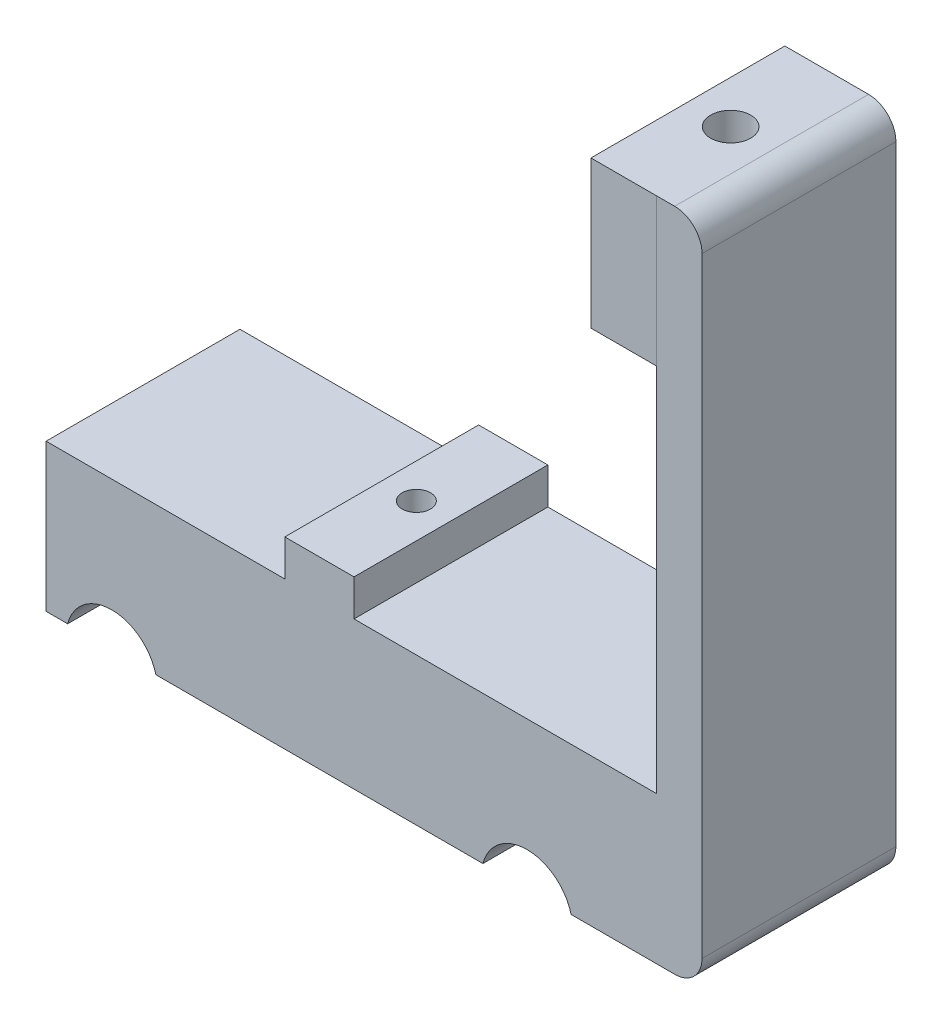
from build123d import *

# Parameters (mm, degrees)
BOSS_EXTRUDE1_DEPTH     = 10.8
BOSS_EXTRUDE2_DEPTH     = 10.64
CUT_EXTRUDE1_DEPTH      = 39.168054705
CUT_EXTRUDE1_DEPTH_BACK = 39.168054705
SKETCH5_R               = 5
FILLET1_R               = 1
SKETCH6_W               = 21.28
SKETCH6_H               = 16.18
BOSS_EXTRUDE3_DEPTH     = 12
SKETCH7_W               = 5
SKETCH7_H               = 21.281328743
BOSS_EXTRUDE4_DEPTH     = 56.83
SKETCH8_W               = 21.284331222
SKETCH8_H               = 16.18
BOSS_EXTRUDE5_DEPTH     = 7.19
FILLET3_R               = 3
SKETCH9_R               = 2.2
CUT_EXTRUDE2_DEPTH      = 85.918196519
SKETCH10_R              = 1.555
CUT_EXTRUDE3_DEPTH      = 85.918196519
SKETCH11_W              = 24.977296572
SKETCH11_H              = 9.721484234
CUT_EXTRUDE4_DEPTH      = 71.220021919


with BuildPart() as part:
    # Sketch2 → Boss-Extrude1 (new body)
    with BuildSketch(Plane.XY):
        Polygon((10.1, 0), (10.1, 1.709943763), (6.25480432, 7), (-6.25480432, 7), (-10.1, 1.709943763), (-10.1, 0), align=None)
    extrude(amount=BOSS_EXTRUDE1_DEPTH)

    # Sketch4 → Boss-Extrude2 (add, symmetric)
    with BuildSketch(Plane.XY):
        Polygon((-3.8, 0), (-3.8, -4.8), (-30, -4.8), (-30, -20.98), (30, -20.98), (30, -4.8), (3.8, -4.8), (3.8, 0), align=None)
    extrude(amount=BOSS_EXTRUDE2_DEPTH, both=True)

    # Sketch5 → Cut-Extrude1 (cut, two sides: drawn at the far end of the back side and taken through both)
    with BuildSketch(Plane.XY.offset(-CUT_EXTRUDE1_DEPTH_BACK)):
        with Locations((-22.790976064, -22.227391232)):
            Circle(SKETCH5_R)
        with Locations((22.790976064, -22.227391232)):
            Circle(SKETCH5_R)
    extrude(amount=CUT_EXTRUDE1_DEPTH + CUT_EXTRUDE1_DEPTH_BACK, mode=Mode.SUBTRACT)

    # Fillet1
    fillet1_edges = [part.edges().sort_by_distance(p)[0] for p in [
        (-10.1, 0, 5.4),
        (-10.1, 1.709943763, 5.4),
        (-6.25480432, 7, 5.4),
        (6.25480432, 7, 5.4),
        (10.1, 0, 5.4),
        (10.1, 1.709943763, 5.4),
    ]]
    fillet(fillet1_edges, radius=FILLET1_R)

    # Sketch6 → Boss-Extrude3 (add)
    with BuildSketch(Plane(origin=(30, 0, 0), x_dir=(0, 0, -1), z_dir=(1, 0, 0))):
        with Locations((0, -12.89)):
            Rectangle(SKETCH6_W, SKETCH6_H)
    extrude(amount=BOSS_EXTRUDE3_DEPTH)

    # Sketch7 → Boss-Extrude4 (add)
    with BuildSketch(Plane(origin=(0, -4.8, 0), x_dir=(1, 0, 0), z_dir=(0, 1, 0))):
        with Locations((39.5, 0.000664372)):
            Rectangle(SKETCH7_W, SKETCH7_H)
    extrude(amount=BOSS_EXTRUDE4_DEPTH)

    # Sketch8 → Boss-Extrude5 (add)
    with BuildSketch(Plane.ZY.offset(-37)):
        with Locations((0.000836868, 43.94)):
            Rectangle(SKETCH8_W, SKETCH8_H)
    extrude(amount=BOSS_EXTRUDE5_DEPTH)

    # Fillet3
    fillet3_edges = [part.edges().sort_by_distance(p)[0] for p in [
        (42, 52.03, -0.000664372),
        (42, -20.98, 0),
    ]]
    fillet(fillet3_edges, radius=FILLET3_R)

    # Sketch9 → Cut-Extrude2 (cut, through all)
    with BuildSketch(Plane.XZ.offset(20.98)):
        with Locations((34.502878078, 0)):
            Circle(SKETCH9_R)
    extrude(amount=-CUT_EXTRUDE2_DEPTH, mode=Mode.SUBTRACT)

    # Sketch10 → Cut-Extrude3 (cut, through all)
    with BuildSketch(Plane.XZ.offset(20.98)):
        with Locations((0.000925951, 0)):
            Circle(SKETCH10_R)
    extrude(amount=-CUT_EXTRUDE3_DEPTH, mode=Mode.SUBTRACT)

    # Sketch11 → Cut-Extrude4 (cut, through all)
    with BuildSketch(Plane.XY.offset(10.8)):
        with Locations((-0.121132817, 4.060742117)):
            Rectangle(SKETCH11_W, SKETCH11_H)
    extrude(amount=-CUT_EXTRUDE4_DEPTH, mode=Mode.SUBTRACT)


solid = part.part
